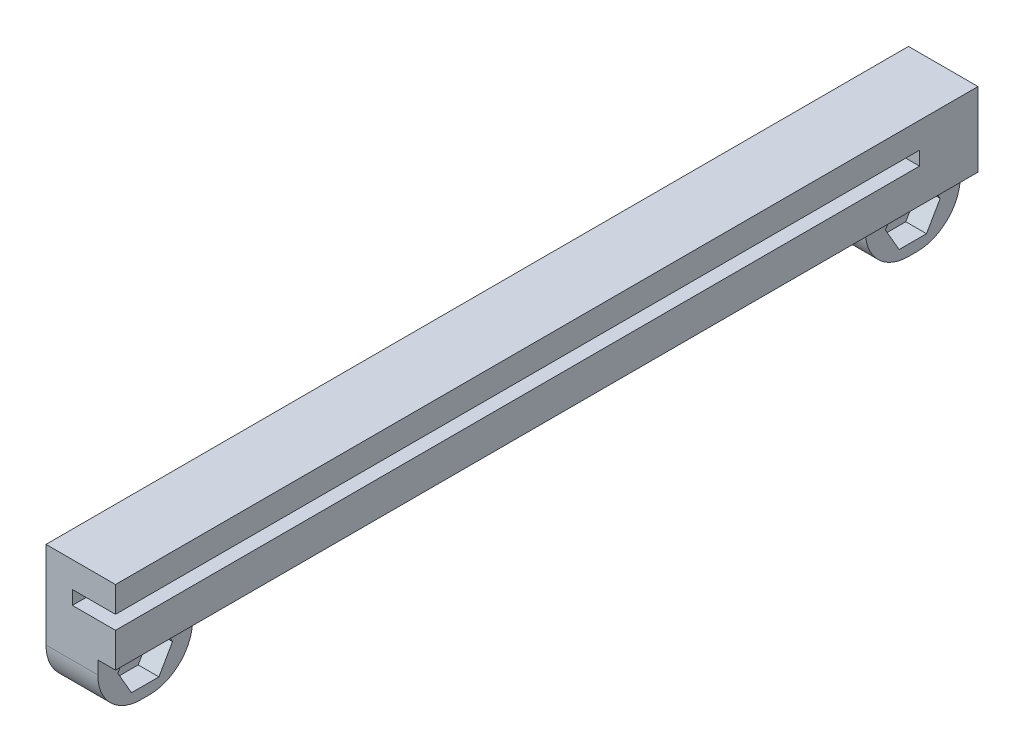
from build123d import *
from build123d.topology import SkipClean

# Parameters (mm, degrees)
SKETCH1_W           = 7.0575
SKETCH1_H           = 100
BOSS_EXTRUDE2_DEPTH = 7.6
SKETCH4_W           = 5
SKETCH4_H           = 93.218
CUT_EXTRUDE1_DEPTH  = 4.6
SKETCH6_W           = 5
SKETCH6_H           = 93.218
BOSS_EXTRUDE3_DEPTH = 3
SKETCH8_W           = 7.0575
SKETCH8_H           = 100
BOSS_EXTRUDE4_DEPTH = 1
SKETCH9_W           = 5
SKETCH9_H           = 11
BOSS_EXTRUDE5_DEPTH = 6.5
CUT_EXTRUDE2_DEPTH  = 2.4
SKETCH11_R          = 1.5
CUT_EXTRUDE3_DEPTH  = 51.77035854
FILLET2_R           = 5
SKETCH13_R          = 1.5
BOSS_EXTRUDE6_DEPTH = 1


with BuildPart() as part:
    # Sketch1 → Boss-Extrude2 (new body)
    with BuildSketch(Plane(origin=(0, 0, 0), x_dir=(1, 0, 0), z_dir=(0, 1, 0))):
        Rectangle(SKETCH1_W, SKETCH1_H)
    extrude(amount=BOSS_EXTRUDE2_DEPTH)

    # Sketch4 → Cut-Extrude1 (cut)
    with BuildSketch(Plane(origin=(0, 7.6, 0), x_dir=(1, 0, 0), z_dir=(0, 1, 0))):
        with Locations((1.02875, -3.391)):
            Rectangle(SKETCH4_W, SKETCH4_H)
    extrude(amount=-CUT_EXTRUDE1_DEPTH, mode=Mode.SUBTRACT)

    # Sketch6 → Boss-Extrude3 (add)
    with BuildSketch(Plane(origin=(0, 7.6, 0), x_dir=(1, 0, 0), z_dir=(0, 1, 0))):
        with Locations((1.02875, -3.391)):
            Rectangle(SKETCH6_W, SKETCH6_H)
    extrude(amount=-BOSS_EXTRUDE3_DEPTH)

    # Sketch8 → Boss-Extrude4 (add)
    with BuildSketch(Plane.XZ):
        Rectangle(SKETCH8_W, SKETCH8_H)
    extrude(amount=BOSS_EXTRUDE4_DEPTH)

    # Sketch9 → Boss-Extrude5 (add)
    with BuildSketch(Plane.XZ.offset(1)):
        with Locations((-1.02875, 44.5)):
            Rectangle(SKETCH9_W, SKETCH9_H)
        with Locations((-1.02875, -44.5)):
            Rectangle(SKETCH9_W, SKETCH9_H)
    extrude(amount=BOSS_EXTRUDE5_DEPTH)

    # Sketch10 → Cut-Extrude2 (cut)
    with BuildSketch(Plane(origin=(1.47125, 0, 0), x_dir=(0, 0, -1), z_dir=(1, 0, 0))):
        Polygon((-46.08771324, -0.75), (-47.675426481, -3.5), (-46.08771324, -6.25), (-42.91228676, -6.25), (-41.324573519, -3.5), (-42.91228676, -0.75), align=None)
        Polygon((47.675426481, -3.5), (46.08771324, -0.75), (42.91228676, -0.75), (41.324573519, -3.5), (42.91228676, -6.25), (46.08771324, -6.25), align=None)
    extrude(amount=-CUT_EXTRUDE2_DEPTH, mode=Mode.SUBTRACT)

    # Sketch11 → Cut-Extrude3 (cut, through all)
    with BuildSketch(Plane(origin=(-0.92875, 0, 0), x_dir=(0, 0, -1), z_dir=(1, 0, 0))):
        with Locations((-44.5, -3.5)):
            Circle(SKETCH11_R)
        with Locations((44.5, -3.5)):
            Circle(SKETCH11_R)
    extrude(amount=-CUT_EXTRUDE3_DEPTH, mode=Mode.SUBTRACT)

    # Fillet2
    fillet2_edges = [part.edges().sort_by_distance(p)[0] for p in [
        (-1.02875, -7.5, -50),
        (-1.02875, -7.5, -39),
        (-1.02875, -7.5, 39),
        (-1.02875, -7.5, 50),
    ]]
    fillet(fillet2_edges, radius=FILLET2_R)

    # Sketch13 → Boss-Extrude6 (add)
    with SkipClean():  # the faces are left unmerged after this step: merging them gives an invalid solid
        with BuildSketch(Plane.ZY.offset(3.52875)):
            with BuildLine():
                Line((-45, -7.5), (-44, -7.5))
                ThreePointArc((-44, -7.5), (-40.464466094, -6.035533906), (-39, -2.5))
                Line((-39, -2.5), (-39, -1))
                Line((-39, -1), (39, -1))
                Line((39, -1), (39, -2.5))
                ThreePointArc((39, -2.5), (40.464466094, -6.035533906), (44, -7.5))
                Line((44, -7.5), (45, -7.5))
                ThreePointArc((45, -7.5), (48.535533906, -6.035533906), (50, -2.5))
                Line((50, -2.5), (50, 7.6))
                Line((50, 7.6), (-50, 7.6))
                Line((-50, 7.6), (-50, -2.5))
                ThreePointArc((-50, -2.5), (-48.535533906, -6.035533906), (-45, -7.5))
            make_face()
            with Locations((-44.5, -3.5)):
                Circle(SKETCH13_R, mode=Mode.SUBTRACT)
            with Locations((44.5, -3.5)):
                Circle(SKETCH13_R, mode=Mode.SUBTRACT)
        extrude(amount=BOSS_EXTRUDE6_DEPTH)


solid = part.part
